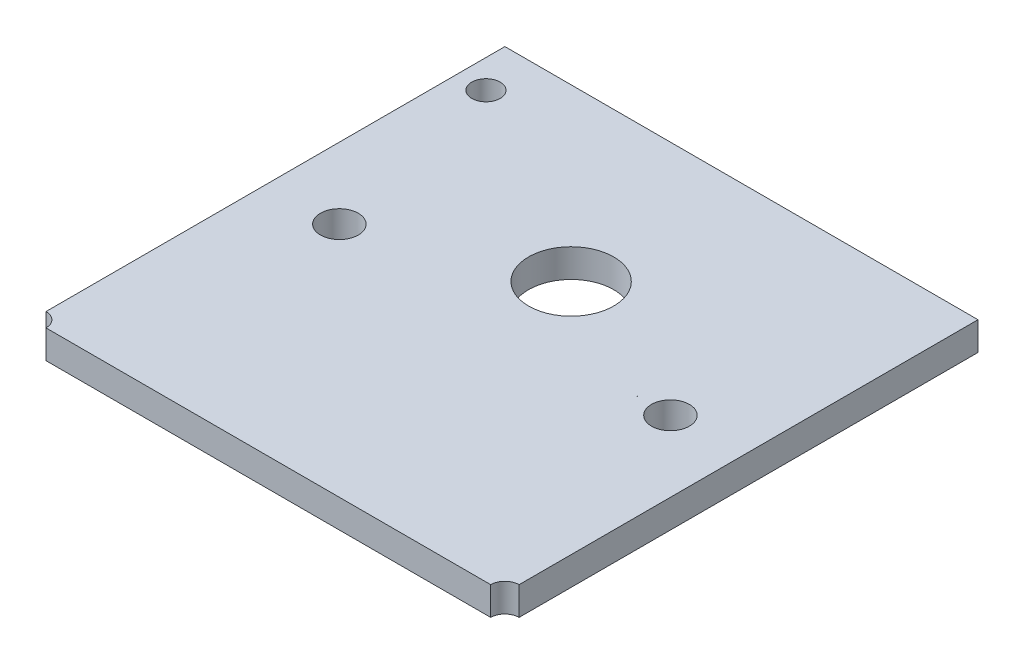
from build123d import *

# Parameters (mm, degrees)
SKETCH1_R           = 1.5
SKETCH1_R_2         = 2
SKETCH1_R_3         = 4.5
BOSS_EXTRUDE1_DEPTH = 3


with BuildPart() as part:
    # Sketch1 → Boss-Extrude1 (new body)
    with BuildSketch(Plane(origin=(0, 0, 0), x_dir=(1, 0, 0), z_dir=(0, 1, 0))):
        with BuildLine():
            ThreePointArc((-25, -23.5), (-23.939339828, -23.939339828), (-23.5, -25))
            Line((-23.5, -25), (23.5, -25))
            ThreePointArc((23.5, -25), (23.939339828, -23.939339828), (25, -23.5))
            Line((25, -23.5), (25, 25))
            Line((25, 25), (-25, 25))
            Line((-25, 25), (-25, -23.5))
        make_face()
        with Locations((-22, 20)):
            Circle(SKETCH1_R, mode=Mode.SUBTRACT)
        with Locations((-17.495441712, 0)):
            Circle(SKETCH1_R_2, mode=Mode.SUBTRACT)
        with BuildLine():
            ThreePointArc((-13.999088699, -0.159736057), (-14, 0), (-13.999088699, 0.159736057))
            ThreePointArc((-13.999088699, 0.159736057), (-13.995441712, 0), (-13.999088699, -0.159736057))
        make_face(mode=Mode.SUBTRACT)
        with BuildLine():
            ThreePointArc((13.999088699, -0.159736057), (13.995441712, 0), (13.999088699, 0.159736057))
            ThreePointArc((13.999088699, 0.159736057), (14, 0), (13.999088699, -0.159736057))
        make_face(mode=Mode.SUBTRACT)
        with Locations((0, 7)):
            Circle(SKETCH1_R_3, mode=Mode.SUBTRACT)
        with Locations((17.495441712, 0)):
            Circle(SKETCH1_R_2, mode=Mode.SUBTRACT)
    extrude(amount=BOSS_EXTRUDE1_DEPTH)


solid = part.part
